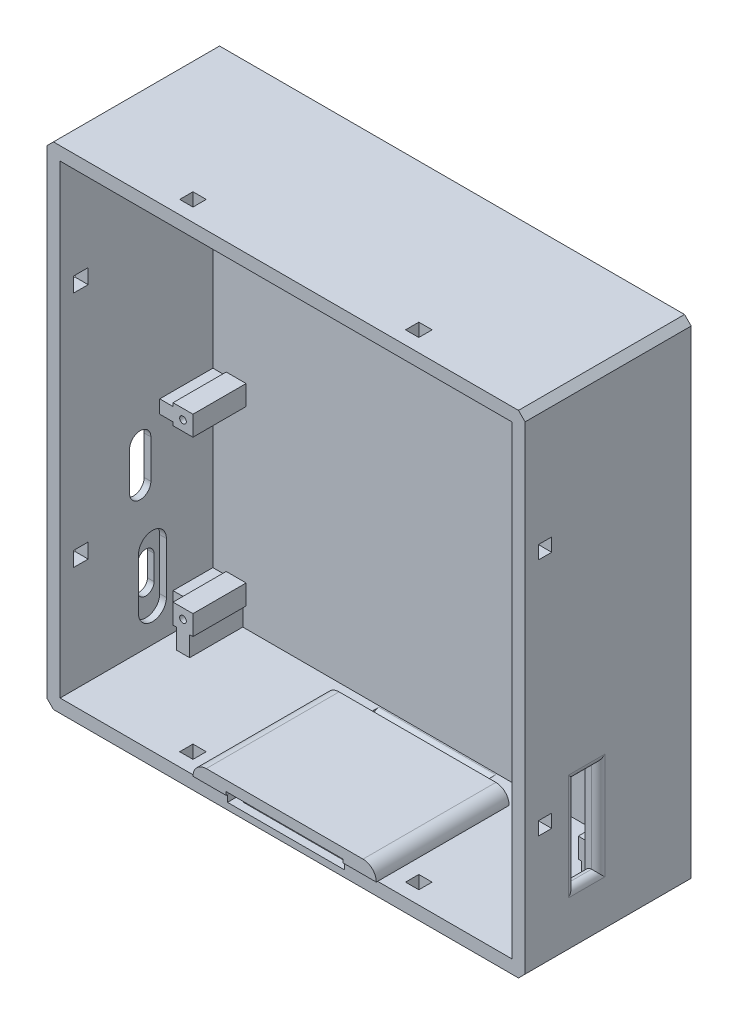
from build123d import *

# Parameters (mm, degrees)
SKETCH_1_W           = 72
SKETCH_1_H           = 74
EXTRUDE_1_DEPTH      = 25
SKETCH_2_W           = 68
SKETCH_2_H           = 70
CUT_EXTRUDE_1_DEPTH  = 23
CUT_EXTRUDE_2_REACH  = 93.259
SKETCH_3_W           = 2
SKETCH_3_H           = 2
CUT_EXTRUDE_3_REACH  = 90.578
SKETCH_4_W           = 2
SKETCH_4_H           = 2
CUT_EXTRUDE_4_REACH  = 93.259
SKETCH_5_W           = 2
SKETCH_5_H           = 2
CUT_EXTRUDE_5_REACH  = 90.578
SKETCH_6_W           = 2.225296774
SKETCH_6_H           = 2.225296773
SKETCH_6_H_2         = 2.225296774
SKETCH_7_W           = 3
SKETCH_7_H           = 3
EXTRUDE_2_DEPTH      = 8
SKETCH_10_R          = 0.5
CUT_EXTRUDE_6_DEPTH  = 6
EXTRUDE_3_REACH      = 89.006
SKETCH_12_W          = 6
SKETCH_12_H          = 2
SKETCH_12_W_2        = 8
EXTRUDE_4_REACH      = 89.006
SKETCH_13_W          = 8
SKETCH_13_H          = 2
EXTRUDE_5_REACH      = 90.911
SKETCH_14_W          = 2
SKETCH_14_H          = 8
SKETCH_14_H_2        = 5.942409556
CUT_EXTRUDE_8_DEPTH  = 1
CUT_EXTRUDE_9_DEPTH  = 1
CUT_EXTRUDE_10_DEPTH = 1
CUT_EXTRUDE_11_DEPTH = 1
CUT_EXTRUDE_12_REACH = 92.167
SKETCH_21_W          = 3.5
SKETCH_21_H          = 14
SKETCH_22_W          = 17.6
SKETCH_22_H          = 21.8
CUT_EXTRUDE_13_DEPTH = 1
SKETCH_24_W          = 15.2
SKETCH_24_H          = 15.2
CUT_EXTRUDE_14_DEPTH = 1
SKETCH_27_W          = 27.6
SKETCH_27_H          = 20
EXTRUDE_6_DEPTH      = 2
CUT_EXTRUDE_16_REACH = 75.995
SKETCH_28_W          = 17.602386018
SKETCH_28_H          = 0.5
FILLET_1_R           = 1
FILLET_2_R           = 2
CHAMFER_1_SIZE       = 1
FILLET_3_R           = 1
FILLET_4_R           = 1
CHAMFER_3_SIZE       = 0.5


with BuildPart() as part:
    # 草图1 → 凸台-拉伸1 (new body)
    with BuildSketch(Plane.XY):
        with Locations((14.191275168, 11.177993267)):
            Rectangle(SKETCH_1_W, SKETCH_1_H)
    extrude(amount=EXTRUDE_1_DEPTH)

    # 草图2 → 切除-拉伸1 (cut)
    with BuildSketch(Plane.XY.offset(25)):
        with Locations((14.191275168, 11.177993267)):
            Rectangle(SKETCH_2_W, SKETCH_2_H)
    extrude(amount=-CUT_EXTRUDE_1_DEPTH, mode=Mode.SUBTRACT)

    # 草图3 → 切除-拉伸2 (cut, up to next)
    with BuildSketch(Plane.XZ.offset(-46.177993267), mode=Mode.PRIVATE) as cut_extrude_2_sk1:
        with Locations((-2.808724832, 22)):
            Rectangle(SKETCH_3_W, SKETCH_3_H)
    cut_extrude_2_tool1 = extrude(cut_extrude_2_sk1.sketch, amount=-CUT_EXTRUDE_2_REACH, mode=Mode.PRIVATE) & part.part
    # 草图3 → 切除-拉伸2 (cut, up to next)
    with BuildSketch(Plane.XZ.offset(-46.177993267), mode=Mode.PRIVATE) as cut_extrude_2_sk2:
        with Locations((31.191275168, 22)):
            Rectangle(SKETCH_3_W, SKETCH_3_H)
    cut_extrude_2_tool2 = extrude(cut_extrude_2_sk2.sketch, amount=-CUT_EXTRUDE_2_REACH, mode=Mode.PRIVATE) & part.part
    add(cut_extrude_2_tool1.solids().sort_by_distance((-2.808725, 46.177993, 22))[0], mode=Mode.SUBTRACT)
    add(cut_extrude_2_tool2.solids().sort_by_distance((31.191275, 46.177993, 22))[0], mode=Mode.SUBTRACT)

    # 草图4 → 切除-拉伸3 (cut, up to next)
    with BuildSketch(Plane.ZY.offset(-48.191275168), mode=Mode.PRIVATE) as cut_extrude_3_sk1:
        with Locations((22, 29.177993267)):
            Rectangle(SKETCH_4_W, SKETCH_4_H)
    cut_extrude_3_tool1 = extrude(cut_extrude_3_sk1.sketch, amount=-CUT_EXTRUDE_3_REACH, mode=Mode.PRIVATE) & part.part
    # 草图4 → 切除-拉伸3 (cut, up to next)
    with BuildSketch(Plane.ZY.offset(-48.191275168), mode=Mode.PRIVATE) as cut_extrude_3_sk2:
        with Locations((22, -6.822006733)):
            Rectangle(SKETCH_4_W, SKETCH_4_H)
    cut_extrude_3_tool2 = extrude(cut_extrude_3_sk2.sketch, amount=-CUT_EXTRUDE_3_REACH, mode=Mode.PRIVATE) & part.part
    add(cut_extrude_3_tool1.solids().sort_by_distance((48.191275, 29.177993, 22))[0], mode=Mode.SUBTRACT)
    add(cut_extrude_3_tool2.solids().sort_by_distance((48.191275, -6.822007, 22))[0], mode=Mode.SUBTRACT)

    # 草图5 → 切除-拉伸4 (cut, up to next)
    with BuildSketch(Plane(origin=(0, -23.822006733, 0), x_dir=(1, 0, 0), z_dir=(0, 1, 0)), mode=Mode.PRIVATE) as cut_extrude_4_sk1:
        with Locations((31.191275168, -22)):
            Rectangle(SKETCH_5_W, SKETCH_5_H)
    cut_extrude_4_tool1 = extrude(cut_extrude_4_sk1.sketch, amount=-CUT_EXTRUDE_4_REACH, mode=Mode.PRIVATE) & part.part
    # 草图5 → 切除-拉伸4 (cut, up to next)
    with BuildSketch(Plane(origin=(0, -23.822006733, 0), x_dir=(1, 0, 0), z_dir=(0, 1, 0)), mode=Mode.PRIVATE) as cut_extrude_4_sk2:
        with Locations((-2.808724832, -22)):
            Rectangle(SKETCH_5_W, SKETCH_5_H)
    cut_extrude_4_tool2 = extrude(cut_extrude_4_sk2.sketch, amount=-CUT_EXTRUDE_4_REACH, mode=Mode.PRIVATE) & part.part
    add(cut_extrude_4_tool1.solids().sort_by_distance((31.191275, -23.822007, 22))[0], mode=Mode.SUBTRACT)
    add(cut_extrude_4_tool2.solids().sort_by_distance((-2.808725, -23.822007, 22))[0], mode=Mode.SUBTRACT)

    # 草图6 → 切除-拉伸5 (cut, up to next)
    with BuildSketch(Plane(origin=(-19.808724832, 0, 0), x_dir=(0, 0, -1), z_dir=(1, 0, 0)), mode=Mode.PRIVATE) as cut_extrude_5_sk1:
        with Locations((-21.887351613, 29.06534488)):
            Rectangle(SKETCH_6_W, SKETCH_6_H)
    cut_extrude_5_tool1 = extrude(cut_extrude_5_sk1.sketch, amount=-CUT_EXTRUDE_5_REACH, mode=Mode.PRIVATE) & part.part
    # 草图6 → 切除-拉伸5 (cut, up to next)
    with BuildSketch(Plane(origin=(-19.808724832, 0, 0), x_dir=(0, 0, -1), z_dir=(1, 0, 0)), mode=Mode.PRIVATE) as cut_extrude_5_sk2:
        with Locations((-21.887351613, -6.709358346)):
            Rectangle(SKETCH_6_W, SKETCH_6_H_2)
    cut_extrude_5_tool2 = extrude(cut_extrude_5_sk2.sketch, amount=-CUT_EXTRUDE_5_REACH, mode=Mode.PRIVATE) & part.part
    add(cut_extrude_5_tool1.solids().sort_by_distance((-19.808725, 29.065345, 21.887352))[0], mode=Mode.SUBTRACT)
    add(cut_extrude_5_tool2.solids().sort_by_distance((-19.808725, -6.709358, 21.887352))[0], mode=Mode.SUBTRACT)

    # 草图7 → 凸台-拉伸2 (add)
    with BuildSketch(Plane.XY.offset(2)):
        with Locations((-16.308724832, -19.322006733)):
            Rectangle(SKETCH_7_W, SKETCH_7_H)
        with Locations((-16.308724832, 6.677993267)):
            Rectangle(SKETCH_7_W, SKETCH_7_H)
        with Locations((44.691275168, -19.322006733)):
            Rectangle(SKETCH_7_W, SKETCH_7_H)
        with Locations((44.691275168, 6.677993267)):
            Rectangle(SKETCH_7_W, SKETCH_7_H)
    extrude(amount=EXTRUDE_2_DEPTH)

    # 草图10 → 切除-拉伸6 (cut)
    with BuildSketch(Plane.XY.offset(10)):
        with Locations((44.691275168, 6.677993267)):
            Circle(SKETCH_10_R)
        with Locations((44.691275168, -19.322006733)):
            Circle(SKETCH_10_R)
        with Locations((-16.308724832, -19.322006733)):
            Circle(SKETCH_10_R)
        with Locations((-16.308724832, 6.677993267)):
            Circle(SKETCH_10_R)
    extrude(amount=-CUT_EXTRUDE_6_DEPTH, mode=Mode.SUBTRACT)

    # 草图12 → 凸台-拉伸3 (add, up to next)
    with BuildSketch(Plane.ZY.offset(17.808724832), mode=Mode.PRIVATE) as extrude_3_sk1:
        with Locations((5, -19.322006733)):
            Rectangle(SKETCH_12_W, SKETCH_12_H)
    extrude_3_tool1 = extrude(extrude_3_sk1.sketch, amount=EXTRUDE_3_REACH, mode=Mode.PRIVATE) - part.part
    # 草图12 → 凸台-拉伸3 (add, up to next)
    with BuildSketch(Plane.ZY.offset(17.808724832), mode=Mode.PRIVATE) as extrude_3_sk2:
        with Locations((6, 6.677993267)):
            Rectangle(SKETCH_12_W_2, SKETCH_12_H)
    extrude_3_tool2 = extrude(extrude_3_sk2.sketch, amount=EXTRUDE_3_REACH, mode=Mode.PRIVATE) - part.part
    add(extrude_3_tool1.solids().sort_by_distance((-17.808725, -19.322007, 5))[0])
    add(extrude_3_tool2.solids().sort_by_distance((-17.808725, 6.677993, 6))[0])

    # 草图13 → 凸台-拉伸4 (add, up to next)
    with BuildSketch(Plane(origin=(46.191275168, 0, 0), x_dir=(0, 0, -1), z_dir=(1, 0, 0)), mode=Mode.PRIVATE) as extrude_4_sk1:
        with Locations((-6, 6.677993267)):
            Rectangle(SKETCH_13_W, SKETCH_13_H)
    extrude_4_tool1 = extrude(extrude_4_sk1.sketch, amount=EXTRUDE_4_REACH, mode=Mode.PRIVATE) - part.part
    # 草图13 → 凸台-拉伸4 (add, up to next)
    with BuildSketch(Plane(origin=(46.191275168, 0, 0), x_dir=(0, 0, -1), z_dir=(1, 0, 0)), mode=Mode.PRIVATE) as extrude_4_sk2:
        with Locations((-6, -19.322006733)):
            Rectangle(SKETCH_13_W, SKETCH_13_H)
    extrude_4_tool2 = extrude(extrude_4_sk2.sketch, amount=EXTRUDE_4_REACH, mode=Mode.PRIVATE) - part.part
    add(extrude_4_tool1.solids().sort_by_distance((46.191275, 6.677993, 6))[0])
    add(extrude_4_tool2.solids().sort_by_distance((46.191275, -19.322007, 6))[0])

    # 草图14 → 凸台-拉伸5 (add, up to next)
    with BuildSketch(Plane.XZ.offset(20.822006733), mode=Mode.PRIVATE) as extrude_5_sk1:
        with Locations((-16.308724832, 6)):
            Rectangle(SKETCH_14_W, SKETCH_14_H)
    extrude_5_tool1 = extrude(extrude_5_sk1.sketch, amount=EXTRUDE_5_REACH, mode=Mode.PRIVATE) - part.part
    # 草图14 → 凸台-拉伸5 (add, up to next)
    with BuildSketch(Plane.XZ.offset(20.822006733), mode=Mode.PRIVATE) as extrude_5_sk2:
        with Locations((44.691275168, 7.028795222)):
            Rectangle(SKETCH_14_W, SKETCH_14_H_2)
    extrude_5_tool2 = extrude(extrude_5_sk2.sketch, amount=EXTRUDE_5_REACH, mode=Mode.PRIVATE) - part.part
    add(extrude_5_tool1.solids().sort_by_distance((-16.308725, -20.822007, 6))[0])
    add(extrude_5_tool2.solids().sort_by_distance((44.691275, -20.822007, 7.028795))[0])

    # 草图15 → 切除-拉伸8 (cut)
    with BuildSketch(Plane.ZY.offset(21.808724832)):
        with BuildLine():
            Line((16.54, 3.797993267), (16.54, -2.402006733))
            ThreePointArc((16.54, -2.402006733), (12.94, -6.002006733), (9.34, -2.402006733))
            Line((9.34, -2.402006733), (9.34, 3.797993267))
            ThreePointArc((9.34, 3.797993267), (12.94, 7.397993267), (16.54, 3.797993267))
        make_face()
    extrude(amount=-CUT_EXTRUDE_8_DEPTH, mode=Mode.SUBTRACT)

    # 草图18 → 切除-拉伸9 (cut)
    with BuildSketch(Plane.ZY.offset(20.808724832)):
        with BuildLine():
            Line((14.54, 3.397993267), (14.54, -2.402006733))
            ThreePointArc((14.54, -2.402006733), (12.94, -4.002006733), (11.34, -2.402006733))
            Line((11.34, -2.402006733), (11.34, 3.397993267))
            ThreePointArc((11.34, 3.397993267), (12.94, 4.997993267), (14.54, 3.397993267))
        make_face()
    extrude(amount=-CUT_EXTRUDE_9_DEPTH, mode=Mode.SUBTRACT)

    # 草图19 → 切除-拉伸10 (cut)
    with BuildSketch(Plane(origin=(-19.808724832, 0, 0), x_dir=(0, 0, -1), z_dir=(1, 0, 0))):
        with BuildLine():
            Line((-9, -11.022006733), (-9, -18.722006733))
            ThreePointArc((-9, -18.722006733), (-11.1, -20.822006733), (-13.2, -18.722006733))
            Line((-13.2, -18.722006733), (-13.2, -11.022006733))
            ThreePointArc((-13.2, -11.022006733), (-11.1, -8.922006733), (-9, -11.022006733))
        make_face()
    extrude(amount=-CUT_EXTRUDE_10_DEPTH, mode=Mode.SUBTRACT)

    # 草图20 → 切除-拉伸11 (cut)
    with BuildSketch(Plane(origin=(-20.808724832, 0, 0), x_dir=(0, 0, -1), z_dir=(1, 0, 0))):
        with BuildLine():
            Line((-12.35, -16.722006733), (-12.35, -13.216845353))
            ThreePointArc((-12.35, -13.216845353), (-11.188796635, -11.871989848), (-9.85, -13.040173546))
            Line((-9.85, -13.040173546), (-9.85, -16.722006733))
            ThreePointArc((-9.85, -16.722006733), (-11.1, -17.972006733), (-12.35, -16.722006733))
        make_face()
    extrude(amount=-CUT_EXTRUDE_11_DEPTH, mode=Mode.SUBTRACT)

    # 草图21 → 切除-拉伸12 (cut, up to next)
    with BuildSketch(Plane(origin=(50.191275168, 0, 0), x_dir=(0, 0, -1), z_dir=(1, 0, 0)), mode=Mode.PRIVATE) as cut_extrude_12_sk1:
        with Locations((-15.75, -10.142006733)):
            Rectangle(SKETCH_21_W, SKETCH_21_H)
    cut_extrude_12_tool1 = extrude(cut_extrude_12_sk1.sketch, amount=-CUT_EXTRUDE_12_REACH, mode=Mode.PRIVATE) & part.part
    add(cut_extrude_12_tool1.solids().sort_by_distance((50.191275, -10.142007, 15.75))[0], mode=Mode.SUBTRACT)

    # 草图22 → 切除-拉伸13 (cut)
    with BuildSketch(Plane(origin=(0, -23.822006733, 0), x_dir=(1, 0, 0), z_dir=(0, 1, 0))):
        with Locations((14.191275168, -14.1)):
            Rectangle(SKETCH_22_W, SKETCH_22_H)
    extrude(amount=-CUT_EXTRUDE_13_DEPTH, mode=Mode.SUBTRACT)

    # 草图24 → 切除-拉伸14 (cut)
    with BuildSketch(Plane(origin=(0, -24.822006733, 0), x_dir=(1, 0, 0), z_dir=(0, 1, 0))):
        with Locations((14.191275168, -16.2)):
            Rectangle(SKETCH_24_W, SKETCH_24_H)
    extrude(amount=-CUT_EXTRUDE_14_DEPTH, mode=Mode.SUBTRACT)

    # 草图27 → 凸台-拉伸6 (add)
    with BuildSketch(Plane(origin=(0, -23.822006733, 0), x_dir=(1, 0, 0), z_dir=(0, 1, 0))):
        with Locations((14.191275168, -15.2)):
            Rectangle(SKETCH_27_W, SKETCH_27_H)
    extrude(amount=EXTRUDE_6_DEPTH)

    # 草图28 → 切除-拉伸16 (cut, up to next)
    with BuildSketch(Plane.XY.offset(25.2), mode=Mode.PRIVATE) as cut_extrude_16_sk1:
        with Locations((14.190082159, -23.572006733)):
            Rectangle(SKETCH_28_W, SKETCH_28_H)
    cut_extrude_16_tool1 = extrude(cut_extrude_16_sk1.sketch, amount=-CUT_EXTRUDE_16_REACH, mode=Mode.PRIVATE) & part.part
    add(cut_extrude_16_tool1.solids().sort_by_distance((14.190082, -23.572007, 25.2))[0], mode=Mode.SUBTRACT)

    # 圆角1
    fillet_1_edges = [part.edges().sort_by_distance(p)[0] for p in [
        (14.191275168, -23.822006733, 3.2),
    ]]
    fillet(fillet_1_edges, radius=FILLET_1_R - 0.0001)  # a hair under: the kernel refuses the full size

    # 圆角2
    fillet_2_edges = [part.edges().sort_by_distance(p)[0] for p in [
        (0.391275168, -21.822006733, 15.2),
        (27.991275168, -21.822006733, 15.2),
    ]]
    fillet(fillet_2_edges, radius=FILLET_2_R - 0.0001)  # a hair under: the kernel refuses the full size

    # 倒角1
    chamfer_1_edges = [part.edges().sort_by_distance(p)[0] for p in [
        (-21.808724832, 48.177993267, 12.5),
        (50.191275168, 48.177993267, 12.5),
        (50.191275168, -25.822006733, 12.5),
        (-21.808724832, -25.822006733, 12.5),
    ]]
    chamfer(chamfer_1_edges, length=CHAMFER_1_SIZE)

    # 圆角3
    fillet_3_edges = [part.edges().sort_by_distance(p)[0] for p in [
        (48.191275168, -17.142006733, 15.75),
        (48.191275168, -3.142006733, 15.75),
    ]]
    fillet(fillet_3_edges, radius=FILLET_3_R)

    # 圆角4
    fillet_4_edges = [part.edges().sort_by_distance(p)[0] for p in [
        (50.191275168, -10.142006733, 17.5),
        (50.191275168, -10.142006733, 14),
        (50.191275168, -17.142006733, 15.75),
        (50.191275168, -3.142006733, 15.75),
    ]]
    fillet(fillet_4_edges, radius=FILLET_4_R - 0.0001)  # a hair under: the kernel refuses the full size

    # 倒角3
    chamfer_3_edges = [part.edges().sort_by_distance(p)[0] for p in [
        (6.591275168, -25.822006733, 16.2),
        (14.191275168, -25.822006733, 8.6),
        (21.791275168, -25.822006733, 16.2),
        (14.191275168, -25.822006733, 23.8),
    ]]
    chamfer(chamfer_3_edges, length=CHAMFER_3_SIZE)


solid = part.part
